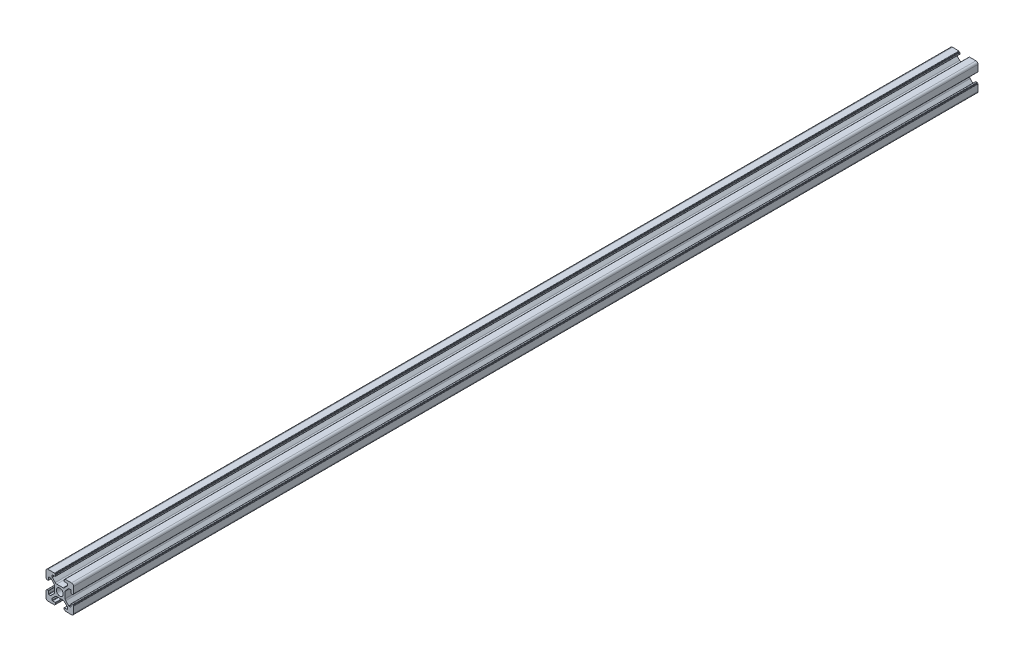
from build123d import *

# Parameters (mm, degrees)
SKETCH_1_R         = 2.5
EXTRUDE_1_DEPTH    = 1220
SKETCH1_R          = 16.771487081
CUT_EXTRUDE1_DEPTH = 657.152490269


with BuildPart() as part:
    # 草图1 → 凸台-拉伸1 (new body)
    with BuildSketch(Plane.XY):
        with BuildLine():
            ThreePointArc((-10.002261885, -8.502261885), (-9.562922057, -9.562922057), (-8.502261885, -10.002261885))
            Line((-8.502261885, -10.002261885), (-3.85, -10.002261885))
            ThreePointArc((-3.85, -10.002261885), (-3.673223305, -9.929038581), (-3.6, -9.752261885))
            Line((-3.6, -9.752261885), (-3.6, -9.502261885))
            Line((-3.6, -9.502261885), (-3.35, -9.502261885))
            ThreePointArc((-3.35, -9.502261885), (-3.173223305, -9.429038581), (-3.1, -9.252261885))
            Line((-3.1, -9.252261885), (-3.1, -8.45))
            ThreePointArc((-3.1, -8.45), (-3.173223305, -8.273223305), (-3.35, -8.2))
            Line((-3.35, -8.2), (-5.25, -8.2))
            ThreePointArc((-5.25, -8.2), (-5.426776695, -8.126776695), (-5.5, -7.95))
            Line((-5.5, -7.95), (-5.5, -6.664213562))
            ThreePointArc((-5.5, -6.664213562), (-5.480969883, -6.568542704), (-5.426776695, -6.487436867))
            Line((-5.426776695, -6.487436867), (-3.278679656, -4.339339828))
            ThreePointArc((-3.278679656, -4.339339828), (-2.792044633, -4.014180701), (-2.218019485, -3.9))
            Line((-2.218019485, -3.9), (2.218019485, -3.9))
            ThreePointArc((2.218019485, -3.9), (2.792044633, -4.014180701), (3.278679656, -4.339339828))
            Line((3.278679656, -4.339339828), (5.426776695, -6.487436867))
            ThreePointArc((5.426776695, -6.487436867), (5.480969883, -6.568542704), (5.5, -6.664213562))
            Line((5.5, -6.664213562), (5.5, -7.95))
            ThreePointArc((5.5, -7.95), (5.426776695, -8.126776695), (5.25, -8.2))
            Line((5.25, -8.2), (3.35, -8.2))
            ThreePointArc((3.35, -8.2), (3.173223305, -8.273223305), (3.1, -8.45))
            Line((3.1, -8.45), (3.1, -9.252261885))
            ThreePointArc((3.1, -9.252261885), (3.173223305, -9.429038581), (3.35, -9.502261885))
            Line((3.35, -9.502261885), (3.6, -9.502261885))
            Line((3.6, -9.502261885), (3.6, -9.752261885))
            ThreePointArc((3.6, -9.752261885), (3.673223305, -9.929038581), (3.85, -10.002261885))
            Line((3.85, -10.002261885), (8.502261885, -10.002261885))
            ThreePointArc((8.502261885, -10.002261885), (9.562922057, -9.562922057), (10.002261885, -8.502261885))
            Line((10.002261885, -8.502261885), (10.002261885, -3.85))
            ThreePointArc((10.002261885, -3.85), (9.929038581, -3.673223305), (9.752261885, -3.6))
            Line((9.752261885, -3.6), (9.502261885, -3.6))
            Line((9.502261885, -3.6), (9.502261885, -3.35))
            ThreePointArc((9.502261885, -3.35), (9.429038581, -3.173223305), (9.252261885, -3.1))
            Line((9.252261885, -3.1), (8.45, -3.1))
            ThreePointArc((8.45, -3.1), (8.273223305, -3.173223305), (8.2, -3.35))
            Line((8.2, -3.35), (8.2, -5.25))
            ThreePointArc((8.2, -5.25), (8.126776695, -5.426776695), (7.95, -5.5))
            Line((7.95, -5.5), (6.664213562, -5.5))
            ThreePointArc((6.664213562, -5.5), (6.568542704, -5.480969883), (6.487436867, -5.426776695))
            Line((6.487436867, -5.426776695), (4.339339828, -3.278679656))
            ThreePointArc((4.339339828, -3.278679656), (4.014180701, -2.792044633), (3.9, -2.218019485))
            Line((3.9, -2.218019485), (3.9, 2.218019485))
            ThreePointArc((3.9, 2.218019485), (4.014180701, 2.792044633), (4.339339828, 3.278679656))
            Line((4.339339828, 3.278679656), (6.487436867, 5.426776695))
            ThreePointArc((6.487436867, 5.426776695), (6.568542704, 5.480969883), (6.664213562, 5.5))
            Line((6.664213562, 5.5), (7.95, 5.5))
            ThreePointArc((7.95, 5.5), (8.126776695, 5.426776695), (8.2, 5.25))
            Line((8.2, 5.25), (8.2, 3.35))
            ThreePointArc((8.2, 3.35), (8.273223305, 3.173223305), (8.45, 3.1))
            Line((8.45, 3.1), (9.252261885, 3.1))
            ThreePointArc((9.252261885, 3.1), (9.429038581, 3.173223305), (9.502261885, 3.35))
            Line((9.502261885, 3.35), (9.502261885, 3.6))
            Line((9.502261885, 3.6), (9.752261885, 3.6))
            ThreePointArc((9.752261885, 3.6), (9.929038581, 3.673223305), (10.002261885, 3.85))
            Line((10.002261885, 3.85), (10.002261885, 8.502261885))
            ThreePointArc((10.002261885, 8.502261885), (9.562922057, 9.562922057), (8.502261885, 10.002261885))
            Line((8.502261885, 10.002261885), (3.85, 10.002261885))
            ThreePointArc((3.85, 10.002261885), (3.673223305, 9.929038581), (3.6, 9.752261885))
            Line((3.6, 9.752261885), (3.6, 9.502261885))
            Line((3.6, 9.502261885), (3.35, 9.502261885))
            ThreePointArc((3.35, 9.502261885), (3.173223305, 9.429038581), (3.1, 9.252261885))
            Line((3.1, 9.252261885), (3.1, 8.45))
            ThreePointArc((3.1, 8.45), (3.173223305, 8.273223305), (3.35, 8.2))
            Line((3.35, 8.2), (5.25, 8.2))
            ThreePointArc((5.25, 8.2), (5.426776695, 8.126776695), (5.5, 7.95))
            Line((5.5, 7.95), (5.5, 6.664213562))
            ThreePointArc((5.5, 6.664213562), (5.480969883, 6.568542704), (5.426776695, 6.487436867))
            Line((5.426776695, 6.487436867), (3.278679656, 4.339339828))
            ThreePointArc((3.278679656, 4.339339828), (2.792044633, 4.014180701), (2.218019485, 3.9))
            Line((2.218019485, 3.9), (-2.218019485, 3.9))
            ThreePointArc((-2.218019485, 3.9), (-2.792044633, 4.014180701), (-3.278679656, 4.339339828))
            Line((-3.278679656, 4.339339828), (-5.426776695, 6.487436867))
            ThreePointArc((-5.426776695, 6.487436867), (-5.480969883, 6.568542704), (-5.5, 6.664213562))
            Line((-5.5, 6.664213562), (-5.5, 7.95))
            ThreePointArc((-5.5, 7.95), (-5.426776695, 8.126776695), (-5.25, 8.2))
            Line((-5.25, 8.2), (-3.35, 8.2))
            ThreePointArc((-3.35, 8.2), (-3.173223305, 8.273223305), (-3.1, 8.45))
            Line((-3.1, 8.45), (-3.1, 9.252261885))
            ThreePointArc((-3.1, 9.252261885), (-3.173223305, 9.429038581), (-3.35, 9.502261885))
            Line((-3.35, 9.502261885), (-3.6, 9.502261885))
            Line((-3.6, 9.502261885), (-3.6, 9.752261885))
            ThreePointArc((-3.6, 9.752261885), (-3.673223305, 9.929038581), (-3.85, 10.002261885))
            Line((-3.85, 10.002261885), (-8.502261885, 10.002261885))
            ThreePointArc((-8.502261885, 10.002261885), (-9.562922057, 9.562922057), (-10.002261885, 8.502261885))
            Line((-10.002261885, 8.502261885), (-10.002261885, 3.85))
            ThreePointArc((-10.002261885, 3.85), (-9.929038581, 3.673223305), (-9.752261885, 3.6))
            Line((-9.752261885, 3.6), (-9.502261885, 3.6))
            Line((-9.502261885, 3.6), (-9.502261885, 3.35))
            ThreePointArc((-9.502261885, 3.35), (-9.429038581, 3.173223305), (-9.252261885, 3.1))
            Line((-9.252261885, 3.1), (-8.45, 3.1))
            ThreePointArc((-8.45, 3.1), (-8.273223305, 3.173223305), (-8.2, 3.35))
            Line((-8.2, 3.35), (-8.2, 5.25))
            ThreePointArc((-8.2, 5.25), (-8.126776695, 5.426776695), (-7.95, 5.5))
            Line((-7.95, 5.5), (-6.664213562, 5.5))
            ThreePointArc((-6.664213562, 5.5), (-6.568542704, 5.480969883), (-6.487436867, 5.426776695))
            Line((-6.487436867, 5.426776695), (-4.339339828, 3.278679656))
            ThreePointArc((-4.339339828, 3.278679656), (-4.014180701, 2.792044633), (-3.9, 2.218019485))
            Line((-3.9, 2.218019485), (-3.9, -2.218019485))
            ThreePointArc((-3.9, -2.218019485), (-4.014180701, -2.792044633), (-4.339339828, -3.278679656))
            Line((-4.339339828, -3.278679656), (-6.487436867, -5.426776695))
            ThreePointArc((-6.487436867, -5.426776695), (-6.568542704, -5.480969883), (-6.664213562, -5.5))
            Line((-6.664213562, -5.5), (-7.95, -5.5))
            ThreePointArc((-7.95, -5.5), (-8.126776695, -5.426776695), (-8.2, -5.25))
            Line((-8.2, -5.25), (-8.2, -3.35))
            ThreePointArc((-8.2, -3.35), (-8.273223305, -3.173223305), (-8.45, -3.1))
            Line((-8.45, -3.1), (-9.252261885, -3.1))
            ThreePointArc((-9.252261885, -3.1), (-9.429038581, -3.173223305), (-9.502261885, -3.35))
            Line((-9.502261885, -3.35), (-9.502261885, -3.6))
            Line((-9.502261885, -3.6), (-9.752261885, -3.6))
            ThreePointArc((-9.752261885, -3.6), (-9.929038581, -3.673223305), (-10.002261885, -3.85))
            Line((-10.002261885, -3.85), (-10.002261885, -8.502261885))
        make_face()
        Circle(SKETCH_1_R, mode=Mode.SUBTRACT)
    extrude(amount=EXTRUDE_1_DEPTH)

    # Sketch1 → Cut-Extrude1 (cut, through all)
    with BuildSketch(Plane.XY.offset(564)):
        Circle(SKETCH1_R)
    extrude(amount=-CUT_EXTRUDE1_DEPTH, mode=Mode.SUBTRACT)


solid = part.part
